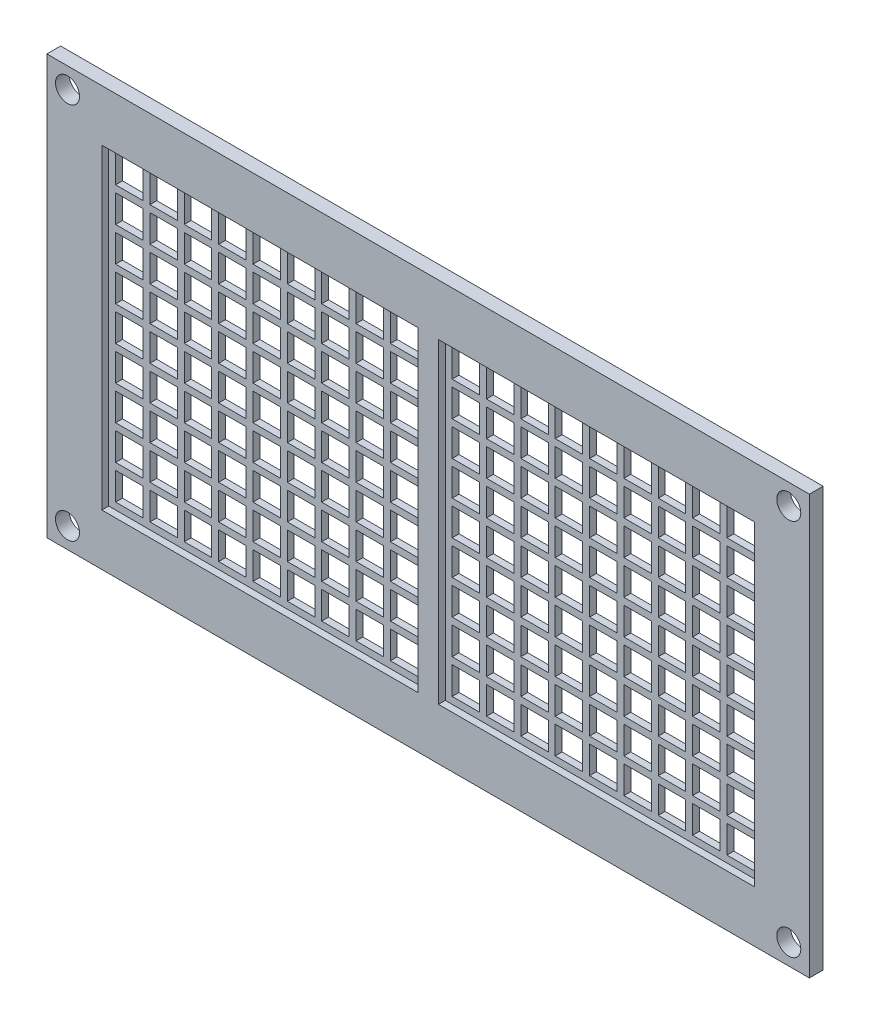
from build123d import *

# Parameters (mm, degrees)
SKETCH1_W           = 111
SKETCH1_H           = 61
SKETCH1_R           = 1.75
BOSS_EXTRUDE1_DEPTH = 2
SKETCH2_W           = 46
SKETCH2_H           = 46
CUT_EXTRUDE1_DEPTH  = 1
SKETCH4_W           = 4
SKETCH4_H           = 4
CUT_EXTRUDE2_DEPTH  = 127.660964784
SKETCH5_W           = 4
SKETCH5_H           = 4
CUT_EXTRUDE5_DEPTH  = 127.672806869


with BuildPart() as part:
    # Sketch1 → Boss-Extrude1 (new body)
    with BuildSketch(Plane.XY):
        with Locations((55.5, 30.5)):
            Rectangle(SKETCH1_W, SKETCH1_H)
        with Locations((108, 3)):
            Circle(SKETCH1_R, mode=Mode.SUBTRACT)
        with Locations((108, 58)):
            Circle(SKETCH1_R, mode=Mode.SUBTRACT)
        with Locations((3, 58)):
            Circle(SKETCH1_R, mode=Mode.SUBTRACT)
        with Locations((3, 3)):
            Circle(SKETCH1_R, mode=Mode.SUBTRACT)
    extrude(amount=BOSS_EXTRUDE1_DEPTH)

    # Sketch2 → Cut-Extrude1 (cut)
    with BuildSketch(Plane.XY.offset(2)):
        with Locations((31, 30.5)):
            Rectangle(SKETCH2_W, SKETCH2_H)
        with Locations((80, 30.5)):
            Rectangle(SKETCH2_W, SKETCH2_H)
    extrude(amount=-CUT_EXTRUDE1_DEPTH, mode=Mode.SUBTRACT)

    # Sketch4 → Cut-Extrude2 (cut, through all)
    with BuildSketch(Plane.XY.offset(1)):
        with Locations((11, 50.5)):
            Rectangle(SKETCH4_W, SKETCH4_H)
        with Locations((16, 50.5)):
            Rectangle(SKETCH4_W, SKETCH4_H)
        with Locations((21, 50.5)):
            Rectangle(SKETCH4_W, SKETCH4_H)
        with Locations((26, 50.5)):
            Rectangle(SKETCH4_W, SKETCH4_H)
        with Locations((31, 50.5)):
            Rectangle(SKETCH4_W, SKETCH4_H)
        with Locations((36, 50.5)):
            Rectangle(SKETCH4_W, SKETCH4_H)
        with Locations((41, 50.5)):
            Rectangle(SKETCH4_W, SKETCH4_H)
        with Locations((46, 50.5)):
            Rectangle(SKETCH4_W, SKETCH4_H)
        with Locations((51, 50.5)):
            Rectangle(SKETCH4_W, SKETCH4_H)
        with Locations((16, 45.5)):
            Rectangle(SKETCH4_W, SKETCH4_H)
        with Locations((21, 45.5)):
            Rectangle(SKETCH4_W, SKETCH4_H)
        with Locations((26, 45.5)):
            Rectangle(SKETCH4_W, SKETCH4_H)
        with Locations((31, 45.5)):
            Rectangle(SKETCH4_W, SKETCH4_H)
        with Locations((36, 45.5)):
            Rectangle(SKETCH4_W, SKETCH4_H)
        with Locations((41, 45.5)):
            Rectangle(SKETCH4_W, SKETCH4_H)
        with Locations((46, 45.5)):
            Rectangle(SKETCH4_W, SKETCH4_H)
        with Locations((51, 45.5)):
            Rectangle(SKETCH4_W, SKETCH4_H)
        with Locations((16, 40.5)):
            Rectangle(SKETCH4_W, SKETCH4_H)
        with Locations((21, 40.5)):
            Rectangle(SKETCH4_W, SKETCH4_H)
        with Locations((26, 40.5)):
            Rectangle(SKETCH4_W, SKETCH4_H)
        with Locations((31, 40.5)):
            Rectangle(SKETCH4_W, SKETCH4_H)
        with Locations((36, 40.5)):
            Rectangle(SKETCH4_W, SKETCH4_H)
        with Locations((41, 40.5)):
            Rectangle(SKETCH4_W, SKETCH4_H)
        with Locations((46, 40.5)):
            Rectangle(SKETCH4_W, SKETCH4_H)
        with Locations((51, 40.5)):
            Rectangle(SKETCH4_W, SKETCH4_H)
        with Locations((16, 35.5)):
            Rectangle(SKETCH4_W, SKETCH4_H)
        with Locations((21, 35.5)):
            Rectangle(SKETCH4_W, SKETCH4_H)
        with Locations((26, 35.5)):
            Rectangle(SKETCH4_W, SKETCH4_H)
        with Locations((31, 35.5)):
            Rectangle(SKETCH4_W, SKETCH4_H)
        with Locations((36, 35.5)):
            Rectangle(SKETCH4_W, SKETCH4_H)
        with Locations((41, 35.5)):
            Rectangle(SKETCH4_W, SKETCH4_H)
        with Locations((46, 35.5)):
            Rectangle(SKETCH4_W, SKETCH4_H)
        with Locations((51, 35.5)):
            Rectangle(SKETCH4_W, SKETCH4_H)
        with Locations((16, 30.5)):
            Rectangle(SKETCH4_W, SKETCH4_H)
        with Locations((21, 30.5)):
            Rectangle(SKETCH4_W, SKETCH4_H)
        with Locations((26, 30.5)):
            Rectangle(SKETCH4_W, SKETCH4_H)
        with Locations((31, 30.5)):
            Rectangle(SKETCH4_W, SKETCH4_H)
        with Locations((36, 30.5)):
            Rectangle(SKETCH4_W, SKETCH4_H)
        with Locations((41, 30.5)):
            Rectangle(SKETCH4_W, SKETCH4_H)
        with Locations((46, 30.5)):
            Rectangle(SKETCH4_W, SKETCH4_H)
        with Locations((51, 30.5)):
            Rectangle(SKETCH4_W, SKETCH4_H)
        with Locations((16, 25.5)):
            Rectangle(SKETCH4_W, SKETCH4_H)
        with Locations((21, 25.5)):
            Rectangle(SKETCH4_W, SKETCH4_H)
        with Locations((26, 25.5)):
            Rectangle(SKETCH4_W, SKETCH4_H)
        with Locations((31, 25.5)):
            Rectangle(SKETCH4_W, SKETCH4_H)
        with Locations((36, 25.5)):
            Rectangle(SKETCH4_W, SKETCH4_H)
        with Locations((41, 25.5)):
            Rectangle(SKETCH4_W, SKETCH4_H)
        with Locations((46, 25.5)):
            Rectangle(SKETCH4_W, SKETCH4_H)
        with Locations((51, 25.5)):
            Rectangle(SKETCH4_W, SKETCH4_H)
        with Locations((16, 20.5)):
            Rectangle(SKETCH4_W, SKETCH4_H)
        with Locations((21, 20.5)):
            Rectangle(SKETCH4_W, SKETCH4_H)
        with Locations((26, 20.5)):
            Rectangle(SKETCH4_W, SKETCH4_H)
        with Locations((31, 20.5)):
            Rectangle(SKETCH4_W, SKETCH4_H)
        with Locations((36, 20.5)):
            Rectangle(SKETCH4_W, SKETCH4_H)
        with Locations((41, 20.5)):
            Rectangle(SKETCH4_W, SKETCH4_H)
        with Locations((46, 20.5)):
            Rectangle(SKETCH4_W, SKETCH4_H)
        with Locations((51, 20.5)):
            Rectangle(SKETCH4_W, SKETCH4_H)
        with Locations((16, 15.5)):
            Rectangle(SKETCH4_W, SKETCH4_H)
        with Locations((21, 15.5)):
            Rectangle(SKETCH4_W, SKETCH4_H)
        with Locations((26, 15.5)):
            Rectangle(SKETCH4_W, SKETCH4_H)
        with Locations((31, 15.5)):
            Rectangle(SKETCH4_W, SKETCH4_H)
        with Locations((36, 15.5)):
            Rectangle(SKETCH4_W, SKETCH4_H)
        with Locations((41, 15.5)):
            Rectangle(SKETCH4_W, SKETCH4_H)
        with Locations((46, 15.5)):
            Rectangle(SKETCH4_W, SKETCH4_H)
        with Locations((51, 15.5)):
            Rectangle(SKETCH4_W, SKETCH4_H)
        with Locations((16, 10.5)):
            Rectangle(SKETCH4_W, SKETCH4_H)
        with Locations((21, 10.5)):
            Rectangle(SKETCH4_W, SKETCH4_H)
        with Locations((26, 10.5)):
            Rectangle(SKETCH4_W, SKETCH4_H)
        with Locations((31, 10.5)):
            Rectangle(SKETCH4_W, SKETCH4_H)
        with Locations((36, 10.5)):
            Rectangle(SKETCH4_W, SKETCH4_H)
        with Locations((41, 10.5)):
            Rectangle(SKETCH4_W, SKETCH4_H)
        with Locations((46, 10.5)):
            Rectangle(SKETCH4_W, SKETCH4_H)
        with Locations((51, 10.5)):
            Rectangle(SKETCH4_W, SKETCH4_H)
        with Locations((11, 45.5)):
            Rectangle(SKETCH4_W, SKETCH4_H)
        with Locations((11, 40.5)):
            Rectangle(SKETCH4_W, SKETCH4_H)
        with Locations((11, 35.5)):
            Rectangle(SKETCH4_W, SKETCH4_H)
        with Locations((11, 30.5)):
            Rectangle(SKETCH4_W, SKETCH4_H)
        with Locations((11, 25.5)):
            Rectangle(SKETCH4_W, SKETCH4_H)
        with Locations((11, 20.5)):
            Rectangle(SKETCH4_W, SKETCH4_H)
        with Locations((11, 15.5)):
            Rectangle(SKETCH4_W, SKETCH4_H)
        with Locations((11, 10.5)):
            Rectangle(SKETCH4_W, SKETCH4_H)
    extrude(amount=-CUT_EXTRUDE2_DEPTH, mode=Mode.SUBTRACT)

    # Sketch5 → Cut-Extrude5 (cut, through all)
    with BuildSketch(Plane.XY):
        with Locations((60, 50.5)):
            Rectangle(SKETCH5_W, SKETCH5_H)
        with Locations((65, 50.5)):
            Rectangle(SKETCH5_W, SKETCH5_H)
        with Locations((70, 50.5)):
            Rectangle(SKETCH5_W, SKETCH5_H)
        with Locations((75, 50.5)):
            Rectangle(SKETCH5_W, SKETCH5_H)
        with Locations((80, 50.5)):
            Rectangle(SKETCH5_W, SKETCH5_H)
        with Locations((85, 50.5)):
            Rectangle(SKETCH5_W, SKETCH5_H)
        with Locations((90, 50.5)):
            Rectangle(SKETCH5_W, SKETCH5_H)
        with Locations((95, 50.5)):
            Rectangle(SKETCH5_W, SKETCH5_H)
        with Locations((100, 50.5)):
            Rectangle(SKETCH5_W, SKETCH5_H)
        with Locations((65, 45.5)):
            Rectangle(SKETCH5_W, SKETCH5_H)
        with Locations((70, 45.5)):
            Rectangle(SKETCH5_W, SKETCH5_H)
        with Locations((75, 45.5)):
            Rectangle(SKETCH5_W, SKETCH5_H)
        with Locations((80, 45.5)):
            Rectangle(SKETCH5_W, SKETCH5_H)
        with Locations((85, 45.5)):
            Rectangle(SKETCH5_W, SKETCH5_H)
        with Locations((90, 45.5)):
            Rectangle(SKETCH5_W, SKETCH5_H)
        with Locations((95, 45.5)):
            Rectangle(SKETCH5_W, SKETCH5_H)
        with Locations((100, 45.5)):
            Rectangle(SKETCH5_W, SKETCH5_H)
        with Locations((65, 40.5)):
            Rectangle(SKETCH5_W, SKETCH5_H)
        with Locations((70, 40.5)):
            Rectangle(SKETCH5_W, SKETCH5_H)
        with Locations((75, 40.5)):
            Rectangle(SKETCH5_W, SKETCH5_H)
        with Locations((80, 40.5)):
            Rectangle(SKETCH5_W, SKETCH5_H)
        with Locations((85, 40.5)):
            Rectangle(SKETCH5_W, SKETCH5_H)
        with Locations((90, 40.5)):
            Rectangle(SKETCH5_W, SKETCH5_H)
        with Locations((95, 40.5)):
            Rectangle(SKETCH5_W, SKETCH5_H)
        with Locations((100, 40.5)):
            Rectangle(SKETCH5_W, SKETCH5_H)
        with Locations((65, 35.5)):
            Rectangle(SKETCH5_W, SKETCH5_H)
        with Locations((70, 35.5)):
            Rectangle(SKETCH5_W, SKETCH5_H)
        with Locations((75, 35.5)):
            Rectangle(SKETCH5_W, SKETCH5_H)
        with Locations((80, 35.5)):
            Rectangle(SKETCH5_W, SKETCH5_H)
        with Locations((85, 35.5)):
            Rectangle(SKETCH5_W, SKETCH5_H)
        with Locations((90, 35.5)):
            Rectangle(SKETCH5_W, SKETCH5_H)
        with Locations((95, 35.5)):
            Rectangle(SKETCH5_W, SKETCH5_H)
        with Locations((100, 35.5)):
            Rectangle(SKETCH5_W, SKETCH5_H)
        with Locations((65, 30.5)):
            Rectangle(SKETCH5_W, SKETCH5_H)
        with Locations((70, 30.5)):
            Rectangle(SKETCH5_W, SKETCH5_H)
        with Locations((75, 30.5)):
            Rectangle(SKETCH5_W, SKETCH5_H)
        with Locations((80, 30.5)):
            Rectangle(SKETCH5_W, SKETCH5_H)
        with Locations((85, 30.5)):
            Rectangle(SKETCH5_W, SKETCH5_H)
        with Locations((90, 30.5)):
            Rectangle(SKETCH5_W, SKETCH5_H)
        with Locations((95, 30.5)):
            Rectangle(SKETCH5_W, SKETCH5_H)
        with Locations((100, 30.5)):
            Rectangle(SKETCH5_W, SKETCH5_H)
        with Locations((65, 25.5)):
            Rectangle(SKETCH5_W, SKETCH5_H)
        with Locations((70, 25.5)):
            Rectangle(SKETCH5_W, SKETCH5_H)
        with Locations((75, 25.5)):
            Rectangle(SKETCH5_W, SKETCH5_H)
        with Locations((80, 25.5)):
            Rectangle(SKETCH5_W, SKETCH5_H)
        with Locations((85, 25.5)):
            Rectangle(SKETCH5_W, SKETCH5_H)
        with Locations((90, 25.5)):
            Rectangle(SKETCH5_W, SKETCH5_H)
        with Locations((95, 25.5)):
            Rectangle(SKETCH5_W, SKETCH5_H)
        with Locations((100, 25.5)):
            Rectangle(SKETCH5_W, SKETCH5_H)
        with Locations((65, 20.5)):
            Rectangle(SKETCH5_W, SKETCH5_H)
        with Locations((70, 20.5)):
            Rectangle(SKETCH5_W, SKETCH5_H)
        with Locations((75, 20.5)):
            Rectangle(SKETCH5_W, SKETCH5_H)
        with Locations((80, 20.5)):
            Rectangle(SKETCH5_W, SKETCH5_H)
        with Locations((85, 20.5)):
            Rectangle(SKETCH5_W, SKETCH5_H)
        with Locations((90, 20.5)):
            Rectangle(SKETCH5_W, SKETCH5_H)
        with Locations((95, 20.5)):
            Rectangle(SKETCH5_W, SKETCH5_H)
        with Locations((100, 20.5)):
            Rectangle(SKETCH5_W, SKETCH5_H)
        with Locations((65, 15.5)):
            Rectangle(SKETCH5_W, SKETCH5_H)
        with Locations((70, 15.5)):
            Rectangle(SKETCH5_W, SKETCH5_H)
        with Locations((75, 15.5)):
            Rectangle(SKETCH5_W, SKETCH5_H)
        with Locations((80, 15.5)):
            Rectangle(SKETCH5_W, SKETCH5_H)
        with Locations((85, 15.5)):
            Rectangle(SKETCH5_W, SKETCH5_H)
        with Locations((90, 15.5)):
            Rectangle(SKETCH5_W, SKETCH5_H)
        with Locations((95, 15.5)):
            Rectangle(SKETCH5_W, SKETCH5_H)
        with Locations((100, 15.5)):
            Rectangle(SKETCH5_W, SKETCH5_H)
        with Locations((65, 10.5)):
            Rectangle(SKETCH5_W, SKETCH5_H)
        with Locations((70, 10.5)):
            Rectangle(SKETCH5_W, SKETCH5_H)
        with Locations((75, 10.5)):
            Rectangle(SKETCH5_W, SKETCH5_H)
        with Locations((80, 10.5)):
            Rectangle(SKETCH5_W, SKETCH5_H)
        with Locations((85, 10.5)):
            Rectangle(SKETCH5_W, SKETCH5_H)
        with Locations((90, 10.5)):
            Rectangle(SKETCH5_W, SKETCH5_H)
        with Locations((95, 10.5)):
            Rectangle(SKETCH5_W, SKETCH5_H)
        with Locations((100, 10.5)):
            Rectangle(SKETCH5_W, SKETCH5_H)
        with Locations((60, 45.5)):
            Rectangle(SKETCH5_W, SKETCH5_H)
        with Locations((60, 40.5)):
            Rectangle(SKETCH5_W, SKETCH5_H)
        with Locations((60, 35.5)):
            Rectangle(SKETCH5_W, SKETCH5_H)
        with Locations((60, 30.5)):
            Rectangle(SKETCH5_W, SKETCH5_H)
        with Locations((60, 25.5)):
            Rectangle(SKETCH5_W, SKETCH5_H)
        with Locations((60, 20.5)):
            Rectangle(SKETCH5_W, SKETCH5_H)
        with Locations((60, 15.5)):
            Rectangle(SKETCH5_W, SKETCH5_H)
        with Locations((60, 10.5)):
            Rectangle(SKETCH5_W, SKETCH5_H)
    extrude(amount=CUT_EXTRUDE5_DEPTH, mode=Mode.SUBTRACT)


solid = part.part
